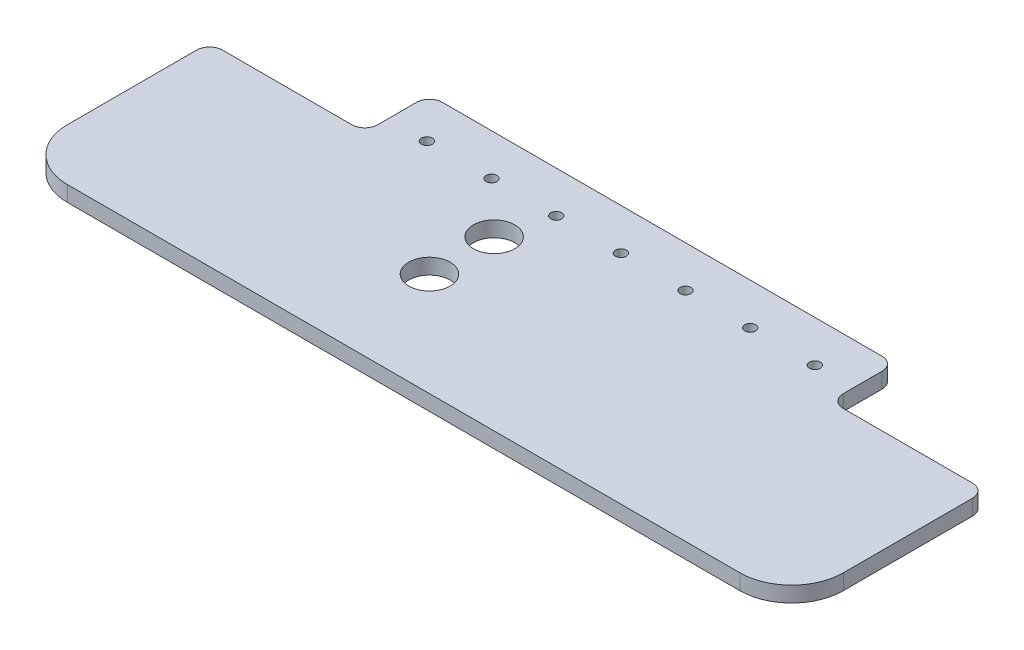
from build123d import *

# Parameters (mm, degrees)
SKETCH_1_R          = 2.1
EXTRUDE_1_DEPTH     = 6
FILLET_1_R          = 5
FILLET_2_R          = 20
CHAMFER_1_SIZE      = 3
FILLET_3_R          = 5
SKETCH_2_R          = 8
CUT_EXTRUDE_1_DEPTH = 10


with BuildPart() as part:
    # 草图1 → 凸台-拉伸1 (new body)
    with BuildSketch(Plane(origin=(0, 0, 0), x_dir=(1, 0, 0), z_dir=(0, 1, 0))):
        Polygon((90, 50), (90, 25), (150, 25), (150, -50), (-150, -50), (-150, 25), (-90, 25), (-90, 50), align=None)
        with Locations((0, 34)):
            Circle(SKETCH_1_R, mode=Mode.SUBTRACT)
        with Locations((25, 34)):
            Circle(SKETCH_1_R, mode=Mode.SUBTRACT)
        with Locations((50, 34)):
            Circle(SKETCH_1_R, mode=Mode.SUBTRACT)
        with Locations((75, 34)):
            Circle(SKETCH_1_R, mode=Mode.SUBTRACT)
        with Locations((-25, 34)):
            Circle(SKETCH_1_R, mode=Mode.SUBTRACT)
        with Locations((-50, 34)):
            Circle(SKETCH_1_R, mode=Mode.SUBTRACT)
        with Locations((-75, 34)):
            Circle(SKETCH_1_R, mode=Mode.SUBTRACT)
    extrude(amount=EXTRUDE_1_DEPTH)

    # 圆角1
    fillet_1_edges = [part.edges().sort_by_distance(p)[0] for p in [
        (-90, 3, -25),
        (-90, 3, -50),
        (90, 3, -25),
        (90, 3, -50),
    ]]
    fillet(fillet_1_edges, radius=FILLET_1_R)

    # 圆角2
    fillet_2_edges = [part.edges().sort_by_distance(p)[0] for p in [
        (150, 3, 50),
        (-150, 3, 50),
    ]]
    fillet(fillet_2_edges, radius=FILLET_2_R)

    # 倒角1
    chamfer_1_edges = [part.edges().sort_by_distance(p)[0] for p in [
        (72.9, 0, -34),
        (47.9, 0, -34),
        (22.9, 0, -34),
        (-2.1, 0, -34),
        (-27.1, 0, -34),
        (-52.1, 0, -34),
        (-77.1, 0, -34),
    ]]
    chamfer(chamfer_1_edges, length=CHAMFER_1_SIZE)

    # 圆角3
    fillet_3_edges = [part.edges().sort_by_distance(p)[0] for p in [
        (-150, 3, -25),
        (150, 3, -25),
    ]]
    fillet(fillet_3_edges, radius=FILLET_3_R)

    # 草图2 → 切除-拉伸1 (cut)
    with BuildSketch(Plane.XZ):
        with Locations((-30, 10)):
            Circle(SKETCH_2_R)
        with Locations((-30, -15)):
            Circle(SKETCH_2_R)
    extrude(amount=-CUT_EXTRUDE_1_DEPTH, mode=Mode.SUBTRACT)


solid = part.part
